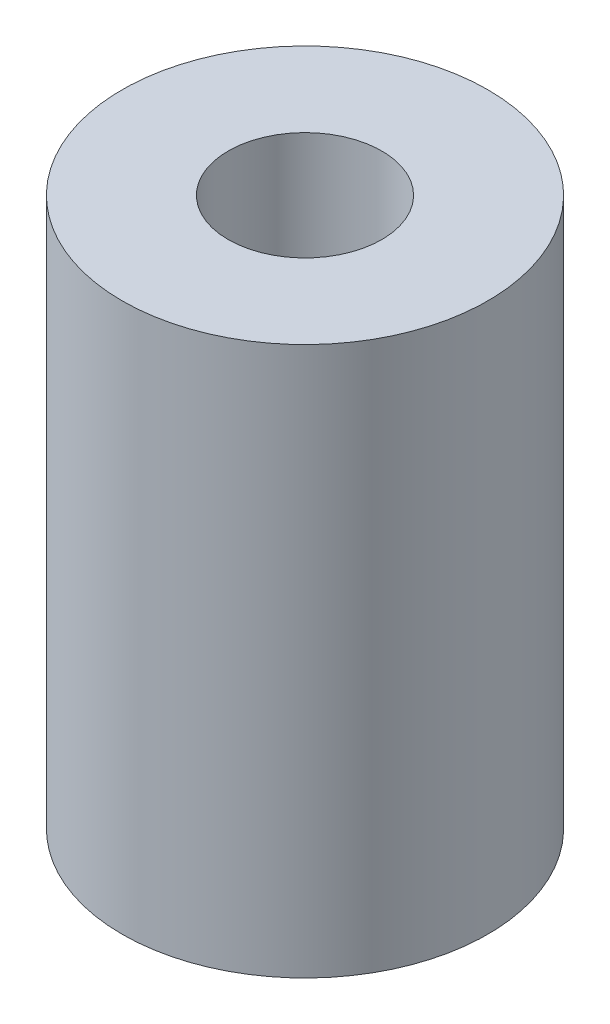
from build123d import *

# Parameters (mm, degrees)
SKETCH_1_R      = 5
SKETCH_1_R_2    = 2.1
EXTRUDE_1_DEPTH = 15


with BuildPart() as part:
    # ｽｹｯﾁ1 → ﾎﾞｽ - 押し出し1 (new body)
    with BuildSketch(Plane(origin=(0, 0, 0), x_dir=(1, 0, 0), z_dir=(0, 1, 0))):
        Circle(SKETCH_1_R)
        Circle(SKETCH_1_R_2, mode=Mode.SUBTRACT)
    extrude(amount=EXTRUDE_1_DEPTH)


solid = part.part
